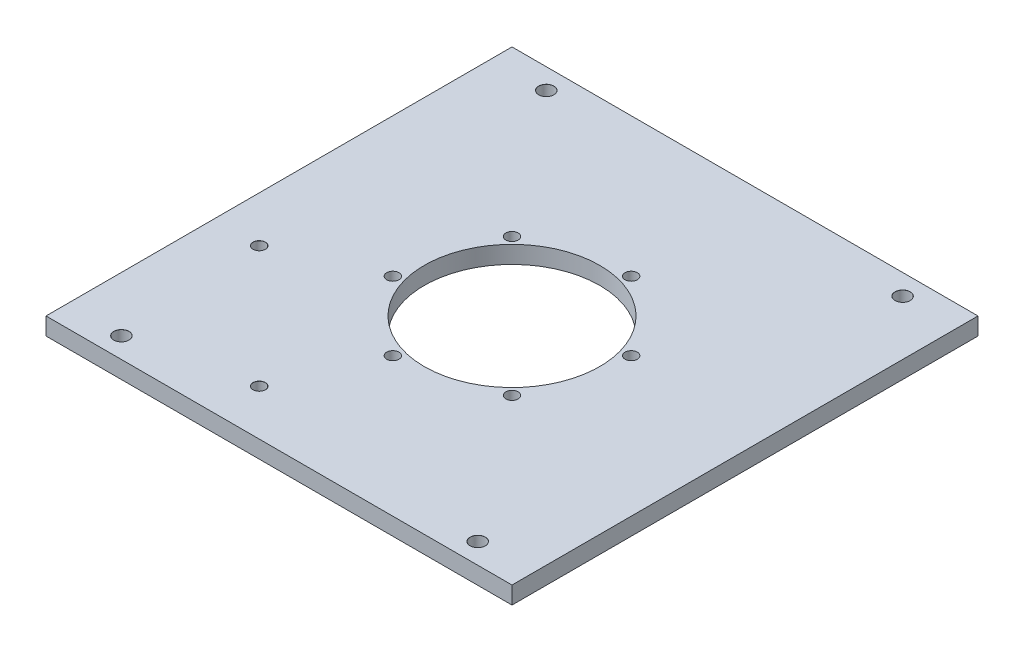
from build123d import *

# Parameters (mm, degrees)
SKETCH1_W                      = 170
SKETCH1_H                      = 170
SKETCH1_R                      = 32
BOSS_EXTRUDE3_DEPTH            = 6.35
M4_CLEARANCE_HOLE2_D           = 4.5
M4_CLEARANCE_HOLE2_CSINK_D     = 4.55
M4_CLEARANCE_HOLE2_CSINK_ANGLE = 90
M4_CLEARANCE_HOLE5_D           = 4.5
M4_CLEARANCE_HOLE5_CSINK_D     = 4.55
M4_CLEARANCE_HOLE5_CSINK_ANGLE = 90
M5_CLEARANCE_HOLE1_D           = 5.5
M5_CLEARANCE_HOLE1_CSINK_D     = 5.55
M5_CLEARANCE_HOLE1_CSINK_ANGLE = 90
M5_CLEARANCE_HOLE2_D           = 5.5
M5_CLEARANCE_HOLE2_CSINK_D     = 5.55
M5_CLEARANCE_HOLE2_CSINK_ANGLE = 90


with BuildPart() as part:
    # Sketch1 → Boss-Extrude3 (new body)
    with BuildSketch(Plane(origin=(0, 0, 0), x_dir=(1, 0, 0), z_dir=(0, 1, 0))):
        Rectangle(SKETCH1_W, SKETCH1_H)
        Circle(SKETCH1_R, mode=Mode.SUBTRACT)
    extrude(amount=BOSS_EXTRUDE3_DEPTH)

    # M4 Clearance Hole2 (through all)
    with Locations(Plane(origin=(0, 0, 0), x_dir=(-1, 0, 0), z_dir=(0, -1, 0))):
        with Locations((-9.188076101, 34.290366833), (25.102290732, 25.102290732), (34.290366833, -9.188076101), (9.188076101, -34.290366833), (-25.102290732, -25.102290732), (-34.290366833, 9.188076101)):
            CounterSinkHole(M4_CLEARANCE_HOLE2_D / 2, M4_CLEARANCE_HOLE2_CSINK_D / 2, counter_sink_angle=M4_CLEARANCE_HOLE2_CSINK_ANGLE)

    # M4 Clearance Hole5 (through all)
    with Locations(Plane(origin=(0, 6.35, 0), x_dir=(1, 0, 0), z_dir=(0, 1, 0))):
        with Locations((-68.301673362, -23.916580707), (-23.916580707, -68.301673362)):
            CounterSinkHole(M4_CLEARANCE_HOLE5_D / 2, M4_CLEARANCE_HOLE5_CSINK_D / 2, counter_sink_angle=M4_CLEARANCE_HOLE5_CSINK_ANGLE)

    # M5 Clearance Hole1 (through all)
    with Locations(Plane(origin=(0, 6.35, 0), x_dir=(1, 0, 0), z_dir=(0, 1, 0))):
        with Locations((-65, -77.5)):
            CounterSinkHole(M5_CLEARANCE_HOLE1_D / 2, M5_CLEARANCE_HOLE1_CSINK_D / 2, counter_sink_angle=M5_CLEARANCE_HOLE1_CSINK_ANGLE)

    # M5 Clearance Hole2 (through all)
    with Locations(Plane(origin=(0, 6.35, 0), x_dir=(1, 0, 0), z_dir=(0, 1, 0))):
        with Locations((-65, 77.5), (65, 77.5), (65, -77.5)):
            CounterSinkHole(M5_CLEARANCE_HOLE2_D / 2, M5_CLEARANCE_HOLE2_CSINK_D / 2, counter_sink_angle=M5_CLEARANCE_HOLE2_CSINK_ANGLE)


solid = part.part
